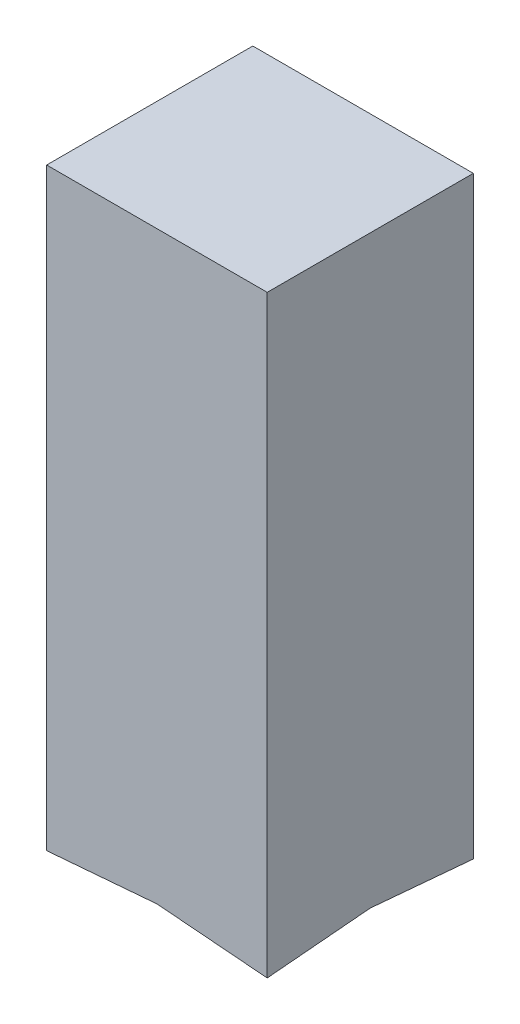
from build123d import *

# Parameters (mm, degrees)
SKETCH1_W           = 20.5
SKETCH1_H           = 19.16
BOSS_EXTRUDE1_DEPTH = 55.2
CUT_EXTRUDE3_DEPTH  = 60.657911462
CUT_EXTRUDE4_DEPTH  = 60.322913785


with BuildPart() as part:
    # Sketch1 → Boss-Extrude1 (new body)
    with BuildSketch(Plane(origin=(0, 0, 0), x_dir=(1, 0, 0), z_dir=(0, 1, 0))):
        Rectangle(SKETCH1_W, SKETCH1_H)
    extrude(amount=-BOSS_EXTRUDE1_DEPTH)

    # Sketch5 → Cut-Extrude3 (cut, through all)
    with BuildSketch(Plane(origin=(10.25, 0, 0), x_dir=(0, 0, -1), z_dir=(1, 0, 0))):
        Polygon((-9.58, -55.2), (0, -54.361858603), (9.58, -55.2), align=None)
    extrude(amount=-CUT_EXTRUDE3_DEPTH, mode=Mode.SUBTRACT)

    # Sketch6 → Cut-Extrude4 (cut, through all)
    with BuildSketch(Plane(origin=(0, 0, -9.58), x_dir=(-1, 0, 0), z_dir=(0, 0, -1))):
        Polygon((-10.25, -55.2), (0, -54.361858603), (10.25, -55.2), align=None)
    extrude(amount=-CUT_EXTRUDE4_DEPTH, mode=Mode.SUBTRACT)


solid = part.part
